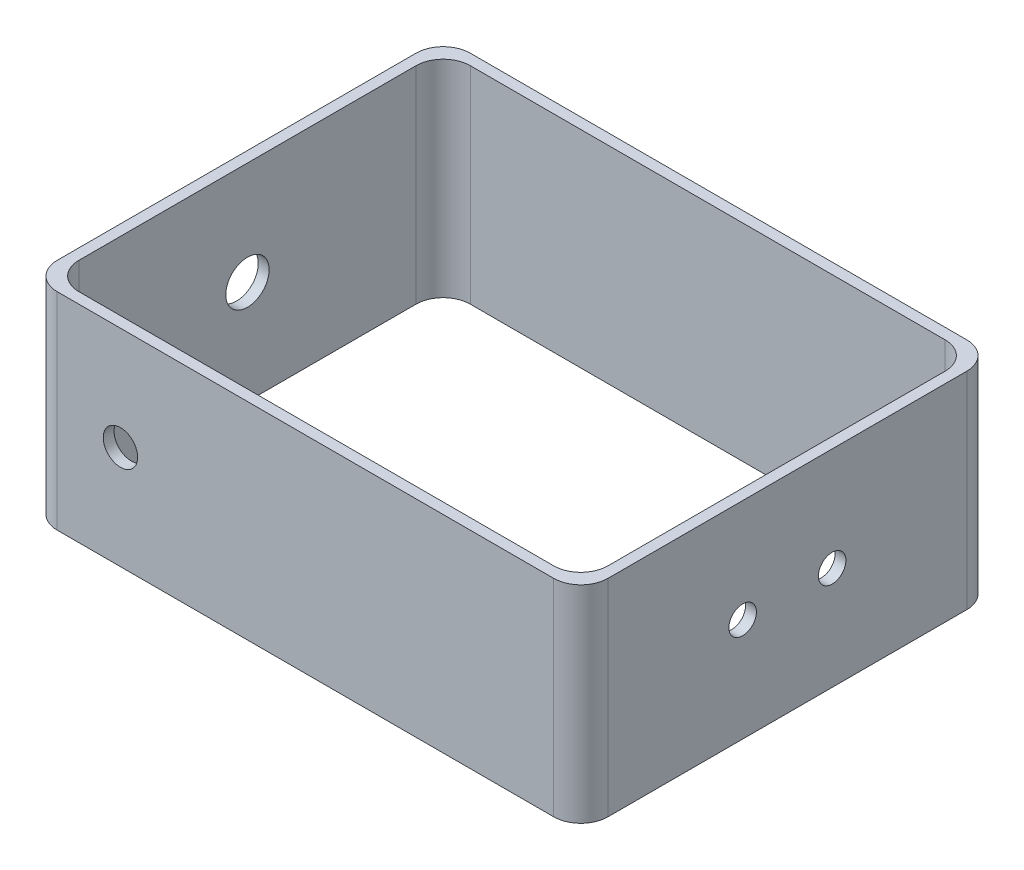
from build123d import *

# Parameters (mm, degrees)
SKETCH1_W           = 101.6
SKETCH1_H           = 76.2
BOSS_EXTRUDE1_DEPTH = 38.1
SKETCH3_W           = 97.6
SKETCH3_H           = 72.2
CUT_EXTRUDE1_DEPTH  = 75.053089065
SKETCH7_R           = 2.54
CUT_EXTRUDE2_DEPTH  = 2
SKETCH9_R           = 4
CUT_EXTRUDE3_DEPTH  = 2
SKETCH11_R          = 3.175
CUT_EXTRUDE4_DEPTH  = 2
FILLET1_R           = 5
FILLET2_R           = 5


with BuildPart() as part:
    # Sketch1 → Boss-Extrude1 (new body)
    with BuildSketch(Plane(origin=(0, 0, 0), x_dir=(1, 0, 0), z_dir=(0, 1, 0))):
        Rectangle(SKETCH1_W, SKETCH1_H)
    extrude(amount=BOSS_EXTRUDE1_DEPTH)

    # Sketch3 → Cut-Extrude1 (cut, through all)
    with BuildSketch(Plane(origin=(0, 38.1, 0), x_dir=(1, 0, 0), z_dir=(0, 1, 0))):
        Rectangle(SKETCH3_W, SKETCH3_H)
    extrude(amount=-CUT_EXTRUDE1_DEPTH, mode=Mode.SUBTRACT)

    # Sketch7 → Cut-Extrude2 (cut)
    with BuildSketch(Plane(origin=(50.8, 0, 0), x_dir=(0, 0, -1), z_dir=(1, 0, 0))):
        with Locations((-8.255, 19.05)):
            Circle(SKETCH7_R)
        with Locations((8.255, 19.05)):
            Circle(SKETCH7_R)
    extrude(amount=-CUT_EXTRUDE2_DEPTH, mode=Mode.SUBTRACT)

    # Sketch9 → Cut-Extrude3 (cut)
    with BuildSketch(Plane.ZY.offset(50.8)):
        with Locations((0, 19.05)):
            Circle(SKETCH9_R)
    extrude(amount=-CUT_EXTRUDE3_DEPTH, mode=Mode.SUBTRACT)

    # Sketch11 → Cut-Extrude4 (cut)
    with BuildSketch(Plane.XY.offset(38.1)):
        with Locations((-34.127797524, 19.05)):
            Circle(SKETCH11_R)
    extrude(amount=-CUT_EXTRUDE4_DEPTH, mode=Mode.SUBTRACT)

    # Fillet1
    fillet1_edges = [part.edges().sort_by_distance(p)[0] for p in [
        (-50.8, 19.05, 38.1),
        (-50.8, 19.05, -38.1),
        (50.8, 19.05, -38.1),
        (50.8, 19.05, 38.1),
    ]]
    fillet(fillet1_edges, radius=FILLET1_R)

    # Fillet2
    fillet2_edges = [part.edges().sort_by_distance(p)[0] for p in [
        (48.8, 19.05, -36.1),
        (48.8, 19.05, 36.1),
        (-48.8, 19.05, -36.1),
        (-48.8, 19.05, 36.1),
    ]]
    fillet(fillet2_edges, radius=FILLET2_R)


solid = part.part
